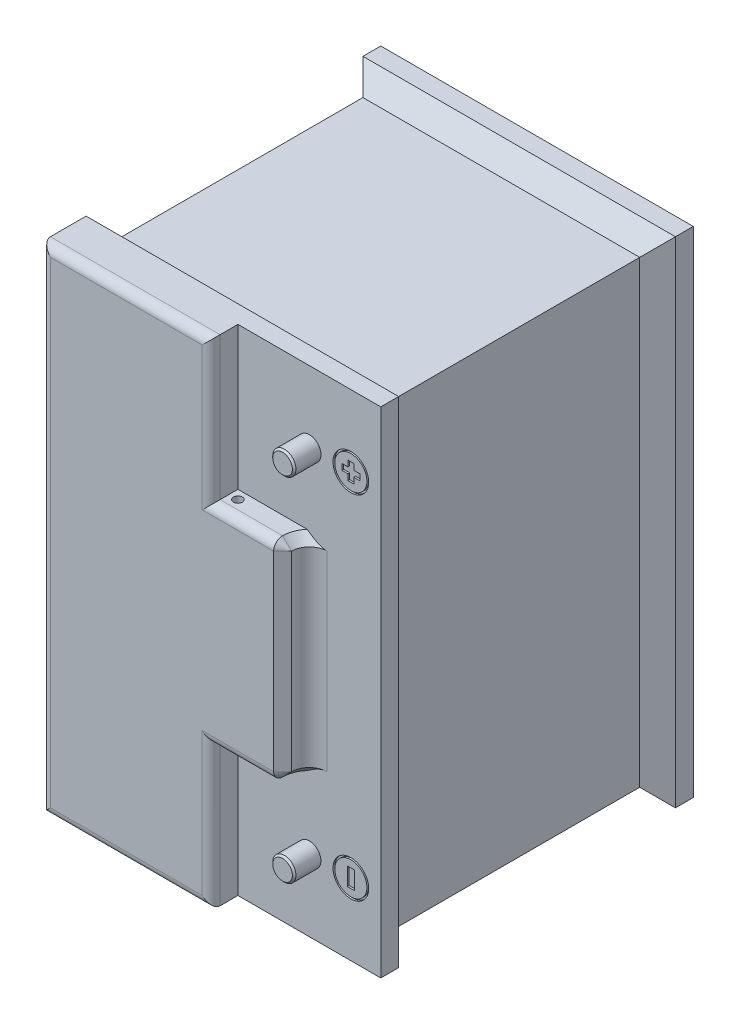
from build123d import *

# Parameters (mm, degrees)
ESQUISSE1_W              = 175
ESQUISSE1_H              = 277
BOSS_EXTRU_2_DEPTH       = 190
ESQUISSE2_W              = 80
ESQUISSE2_H              = 80
ENL_V_MAT_EXTRU_2_DEPTH  = 15
ESQUISSE6_R              = 6.5
BOSS_EXTRU_4_DEPTH       = 15
CHANFREIN2_SIZE          = 1
ENL_V_START              = -10
ESQUISSE12_OUTSIDE_W     = 252.75
ESQUISSE12_OUTSIDE_H     = 354.75
ESQUISSE12_OUTSIDE_W_2   = 155
ESQUISSE12_OUTSIDE_H_2   = 257
ENL_V_MAT_EXTRU_5_DEPTH  = 155
CHANFREIN5_SIZE          = 10
CONG_1_R                 = 5
ENL_V_MAT_EXTRU_10_REACH = 326.86
ESQUISSE13_R             = 2.5
CHANFREIN8_SIZE          = 5
CONG_3_R                 = 10
ESQUISSE14_R             = 10
ESQUISSE14_R_2           = 9
ENL_V_MAT_EXTRU_11_DEPTH = 1
ESQUISSE15_W             = 4
ESQUISSE15_H             = 10
ENL_V_MAT_EXTRU_12_DEPTH = 1


with BuildPart() as part:
    # Esquisse1 → Boss.-Extru.2 (new body)
    with BuildSketch(Plane.XY):
        with Locations((87.5, 138.5)):
            Rectangle(ESQUISSE1_W, ESQUISSE1_H)
    extrude(amount=BOSS_EXTRU_2_DEPTH)

    # Esquisse2 → Enlèv. mat.-Extru.2 (cut)
    with BuildSketch(Plane.XY.offset(190)):
        with Locations((135, 40)):
            Rectangle(ESQUISSE2_W, ESQUISSE2_H)
        with Locations((135, 237)):
            Rectangle(ESQUISSE2_W, ESQUISSE2_H)
    extrude(amount=-ENL_V_MAT_EXTRU_2_DEPTH, mode=Mode.SUBTRACT)

    # Esquisse6 → Boss.-Extru.4 (add)
    with BuildSketch(Plane.XY.offset(175)):
        with Locations((135, 40)):
            Circle(ESQUISSE6_R)
        with Locations(Location((135, 237, 0), (0, 0, 180))):
            Circle(ESQUISSE6_R)
    extrude(amount=BOSS_EXTRU_4_DEPTH)

    # Chanfrein2
    chanfrein2_edges = [part.edges().sort_by_distance(p)[0] for p in [
        (128.5, 40, 190),
        (141.5, 237, 190),
    ]]
    chamfer(chanfrein2_edges, length=CHANFREIN2_SIZE)

    # Esquisse12 outside → Enlèv. mat.-Extru.5 (cut)
    with BuildSketch(Plane(origin=(0, 0, 0), x_dir=(-1, 0, 0), z_dir=(0, 0, -1)).offset(ENL_V_START)):
        with Locations((-87.5, 138.5)):
            Rectangle(ESQUISSE12_OUTSIDE_W, ESQUISSE12_OUTSIDE_H)
        with Locations((-87.5, 138.5)):
            Rectangle(ESQUISSE12_OUTSIDE_W_2, ESQUISSE12_OUTSIDE_H_2, mode=Mode.SUBTRACT)
    extrude(amount=-ENL_V_MAT_EXTRU_5_DEPTH, mode=Mode.SUBTRACT)

    # Chanfrein5
    chanfrein5_edges = [part.edges().sort_by_distance(p)[0] for p in [
        (165, 138.5, 10),
        (87.5, 267, 10),
        (10, 138.5, 10),
        (87.5, 10, 10),
    ]]
    chamfer(chanfrein5_edges, length=CHANFREIN5_SIZE - 0.0001)  # a hair under: the kernel refuses the full size

    # Congé1
    cong_1_edges = [part.edges().sort_by_distance(p)[0] for p in [
        (175, 138.5, 190),
        (135, 80, 190),
        (95, 40, 190),
        (47.5, 277, 190),
        (95, 237, 190),
        (135, 197, 190),
        (0, 138.5, 190),
        (47.5, 0, 190),
    ]]
    fillet(cong_1_edges, radius=CONG_1_R)

    # Esquisse13 → Enlèv. mat.-Extru.10 (cut, up to next)
    with BuildSketch(Plane.XZ.offset(-80), mode=Mode.PRIVATE) as enl_v_mat_extru_10_sk1:
        with Locations((100, 180)):
            Circle(ESQUISSE13_R)
    enl_v_mat_extru_10_tool1 = extrude(enl_v_mat_extru_10_sk1.sketch, amount=-ENL_V_MAT_EXTRU_10_REACH, mode=Mode.PRIVATE) & part.part
    # Esquisse13 → Enlèv. mat.-Extru.10 (cut, up to next)
    with BuildSketch(Plane.XZ.offset(-80), mode=Mode.PRIVATE) as enl_v_mat_extru_10_sk2:
        with BuildLine():
            Line((145, 175), (175, 175))
            Line((175, 175), (175, 190))
            Line((175, 190), (135, 190))
            Line((135, 190), (135, 185))
            ThreePointArc((135, 185), (137.928932188, 177.928932188), (145, 175))
        make_face()
    enl_v_mat_extru_10_tool2 = extrude(enl_v_mat_extru_10_sk2.sketch, amount=-ENL_V_MAT_EXTRU_10_REACH, mode=Mode.PRIVATE) & part.part
    add(enl_v_mat_extru_10_tool1.solids().sort_by_distance((100, 80, 180))[0], mode=Mode.SUBTRACT)
    add(enl_v_mat_extru_10_tool2.solids().sort_by_distance((155.659019, 80, 182.695347))[0], mode=Mode.SUBTRACT)

    # Chanfrein8
    chanfrein8_edges = [part.edges().sort_by_distance(p)[0] for p in [
        (135, 81.464466094, 188.535533906),
        (137.928932188, 80, 177.928932188),
        (137.928932188, 197, 177.928932188),
        (135, 195.535533906, 188.535533906),
        (135, 138.5, 190),
    ]]
    chamfer(chanfrein8_edges, length=CHANFREIN8_SIZE - 0.0001)  # a hair under: the kernel refuses the full size

    # Congé3
    cong_3_edges = [part.edges().sort_by_distance(p)[0] for p in [
        (87.5, 267, 165),
        (165, 138.5, 165),
        (87.5, 10, 165),
        (10, 138.5, 165),
    ]]
    fillet(cong_3_edges, radius=CONG_3_R - 0.0001)  # a hair under: the kernel refuses the full size

    # Esquisse14 → Enlèv. mat.-Extru.11 (cut)
    # profile 1 of 2: a face of its own
    with BuildSketch(Plane.XY.offset(175)):
        with Locations((158.25, 40)):
            Circle(ESQUISSE14_R)
        with Locations((158.25, 40)):
            Circle(ESQUISSE14_R_2, mode=Mode.SUBTRACT)
    # profile 2 of 2: a face of its own
    with BuildSketch(Plane.XY.offset(175)):
        with Locations(Location((158.25, 237, 0), (0, 0, 180))):
            Circle(ESQUISSE14_R)
        with Locations(Location((158.25, 237, 0), (0, 0, 180))):
            Circle(ESQUISSE14_R_2, mode=Mode.SUBTRACT)
    extrude(amount=-ENL_V_MAT_EXTRU_11_DEPTH, mode=Mode.SUBTRACT)

    # Esquisse15 → Enlèv. mat.-Extru.12 (cut)
    with BuildSketch(Plane.XY.offset(175)):
        with Locations((158.25, 40)):
            Rectangle(ESQUISSE15_W, ESQUISSE15_H)
        Polygon((156.583333333, 235.333333333), (153.25, 235.333333333), (153.25, 238.666666667), (156.583333333, 238.666666667), (156.583333333, 242), (159.916666667, 242), (159.916666667, 238.666666667), (163.25, 238.666666667), (163.25, 235.333333333), (159.916666667, 235.333333333), (159.916666667, 232), (156.583333333, 232), align=None)
    extrude(amount=-ENL_V_MAT_EXTRU_12_DEPTH, mode=Mode.SUBTRACT)


solid = part.part
